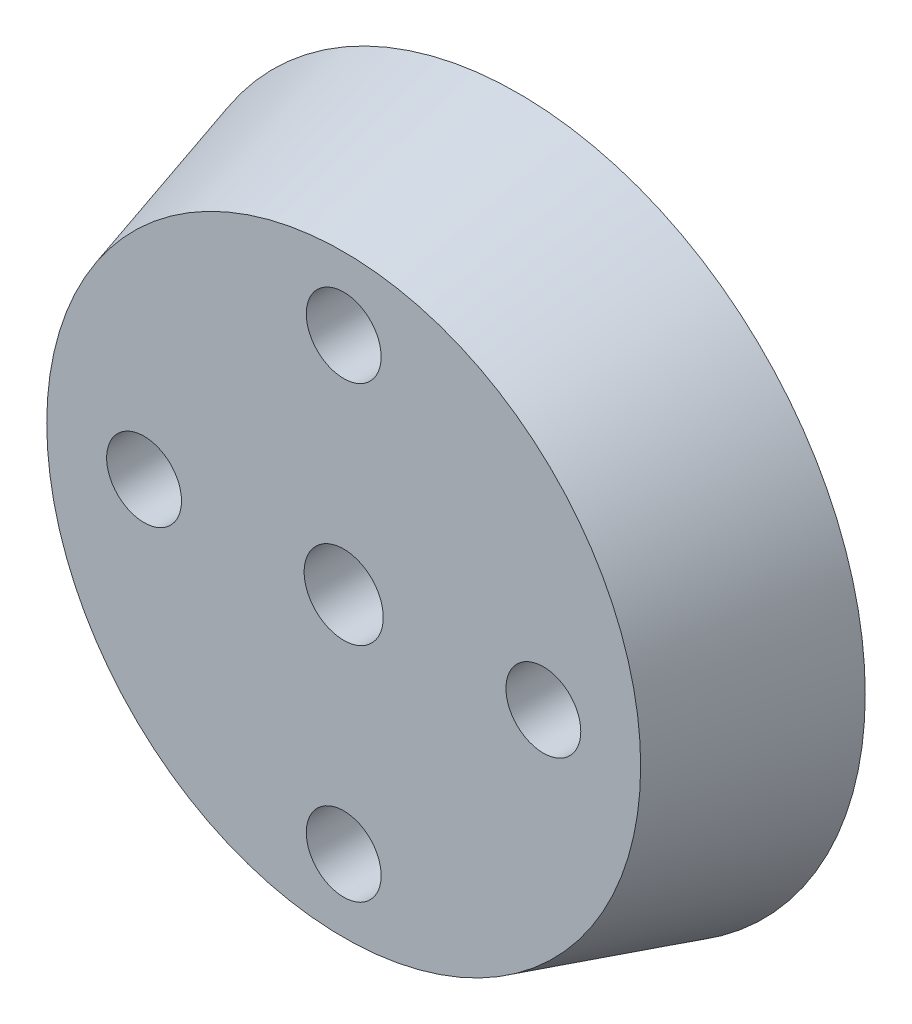
from build123d import *

# Parameters (mm, degrees)
SKETCH1_R           = 13.9
BOSS_EXTRUDE1_DEPTH = 7
CUT_EXTRUDE1_REACH  = 22.867
SKETCH2_R           = 1.585
CUT_EXTRUDE2_REACH  = 22.867
SKETCH3_R           = 1.5
CHAMFER1_SIZE       = 7
CHAMFER1_SIZE_2     = 2


with BuildPart() as part:
    # Sketch1 → Boss-Extrude1 (new body)
    with BuildSketch(Plane.XY):
        Circle(SKETCH1_R)
    extrude(amount=BOSS_EXTRUDE1_DEPTH)

    # Sketch2 → Cut-Extrude1 (cut, up to next)
    with BuildSketch(Plane.XY.offset(7), mode=Mode.PRIVATE) as cut_extrude1_sk1:
        Circle(SKETCH2_R)
    cut_extrude1_tool1 = extrude(cut_extrude1_sk1.sketch, amount=-CUT_EXTRUDE1_REACH, mode=Mode.PRIVATE) & part.part
    add(cut_extrude1_tool1.solids().sort_by_distance((0, 0, 7))[0], mode=Mode.SUBTRACT)

    # Sketch3 → Cut-Extrude2 (cut, up to next)
    with BuildSketch(Plane.XY.offset(7), mode=Mode.PRIVATE) as cut_extrude2_sk1:
        with Locations((-8, 0)):
            Circle(SKETCH3_R)
    cut_extrude2_tool1 = extrude(cut_extrude2_sk1.sketch, amount=-CUT_EXTRUDE2_REACH, mode=Mode.PRIVATE) & part.part
    # Sketch3 → Cut-Extrude2 (cut, up to next)
    with BuildSketch(Plane.XY.offset(7), mode=Mode.PRIVATE) as cut_extrude2_sk2:
        with Locations((8, 0)):
            Circle(SKETCH3_R)
    cut_extrude2_tool2 = extrude(cut_extrude2_sk2.sketch, amount=-CUT_EXTRUDE2_REACH, mode=Mode.PRIVATE) & part.part
    # Sketch3 → Cut-Extrude2 (cut, up to next)
    with BuildSketch(Plane.XY.offset(7), mode=Mode.PRIVATE) as cut_extrude2_sk3:
        with Locations((0, -9)):
            Circle(SKETCH3_R)
    cut_extrude2_tool3 = extrude(cut_extrude2_sk3.sketch, amount=-CUT_EXTRUDE2_REACH, mode=Mode.PRIVATE) & part.part
    # Sketch3 → Cut-Extrude2 (cut, up to next)
    with BuildSketch(Plane.XY.offset(7), mode=Mode.PRIVATE) as cut_extrude2_sk4:
        with Locations((0, 9)):
            Circle(SKETCH3_R)
    cut_extrude2_tool4 = extrude(cut_extrude2_sk4.sketch, amount=-CUT_EXTRUDE2_REACH, mode=Mode.PRIVATE) & part.part
    add(cut_extrude2_tool1.solids().sort_by_distance((-8, 0, 7))[0], mode=Mode.SUBTRACT)
    add(cut_extrude2_tool2.solids().sort_by_distance((8, 0, 7))[0], mode=Mode.SUBTRACT)
    add(cut_extrude2_tool3.solids().sort_by_distance((0, -9, 7))[0], mode=Mode.SUBTRACT)
    add(cut_extrude2_tool4.solids().sort_by_distance((0, 9, 7))[0], mode=Mode.SUBTRACT)

    # Chamfer1
    # the kernel refuses this chamfer: 7, 2 mm, written as the material it takes off along each edge
    with BuildSketch(Plane(origin=(0, 0, 7), x_dir=(1, 0, 0), z_dir=(0, -1, 0))) as chamfer1_piece_1:
        Polygon((13.9, -CHAMFER1_SIZE), (13.9 - CHAMFER1_SIZE_2, 0), (13.9, 0), align=None)
    revolve(axis=Axis((0, 0, 7), (0, 0, 1)), mode=Mode.SUBTRACT)


solid = part.part
